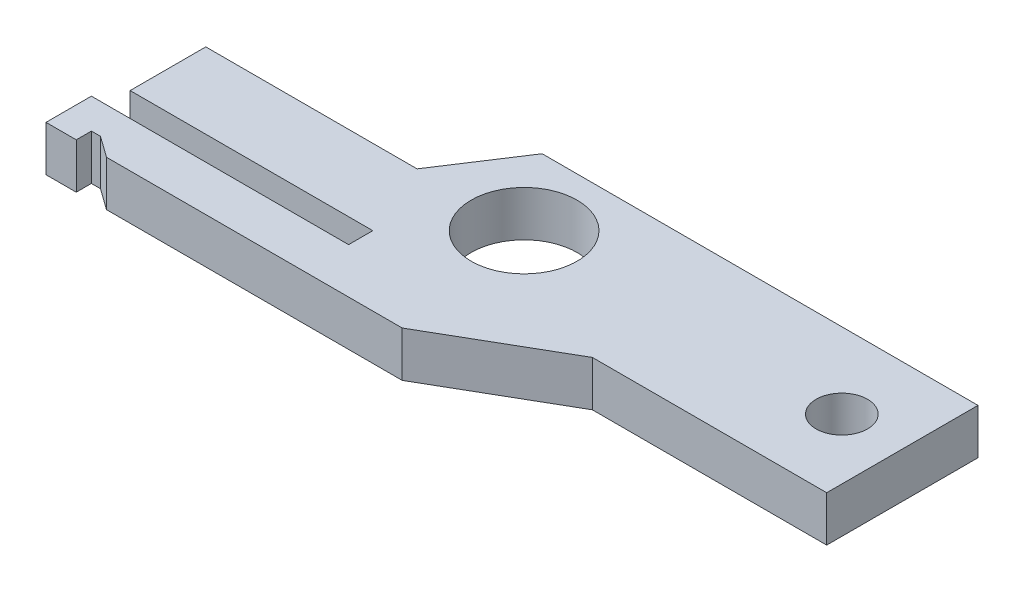
from build123d import *

# Parameters (mm, degrees)
SKETCH_2_R      = 0.85
SKETCH_2_R_2    = 1.75
EXTRUDE_1_DEPTH = 1.5


with BuildPart() as part:
    # 草图2 → 凸台-拉伸1 (new body)
    with BuildSketch(Plane(origin=(0, 7.096792112, 0), x_dir=(1, 0, 0), z_dir=(0, 1, 0))):
        Polygon((-1.9, 0), (-10.4, 0), (-10.4, -1.5), (-9.4, -1.5), (-9.4, -1), (-9.1, -1), (-8.4, -1.5), (1.371788561, -1.5), (5.355505418, 0.8), (13.1, 0.8), (13.1, 5.8), (-1.303412873, 5.8), (-2.936751866, 3.3), (-9.919467953, 3.3), (-9.919467953, 0.8), (-1.9, 0.8), align=None)
        with Locations((11.1, 3.3)):
            Circle(SKETCH_2_R, mode=Mode.SUBTRACT)
        with Locations((0.6, 3.3)):
            Circle(SKETCH_2_R_2, mode=Mode.SUBTRACT)
    extrude(amount=-EXTRUDE_1_DEPTH)


solid = part.part
